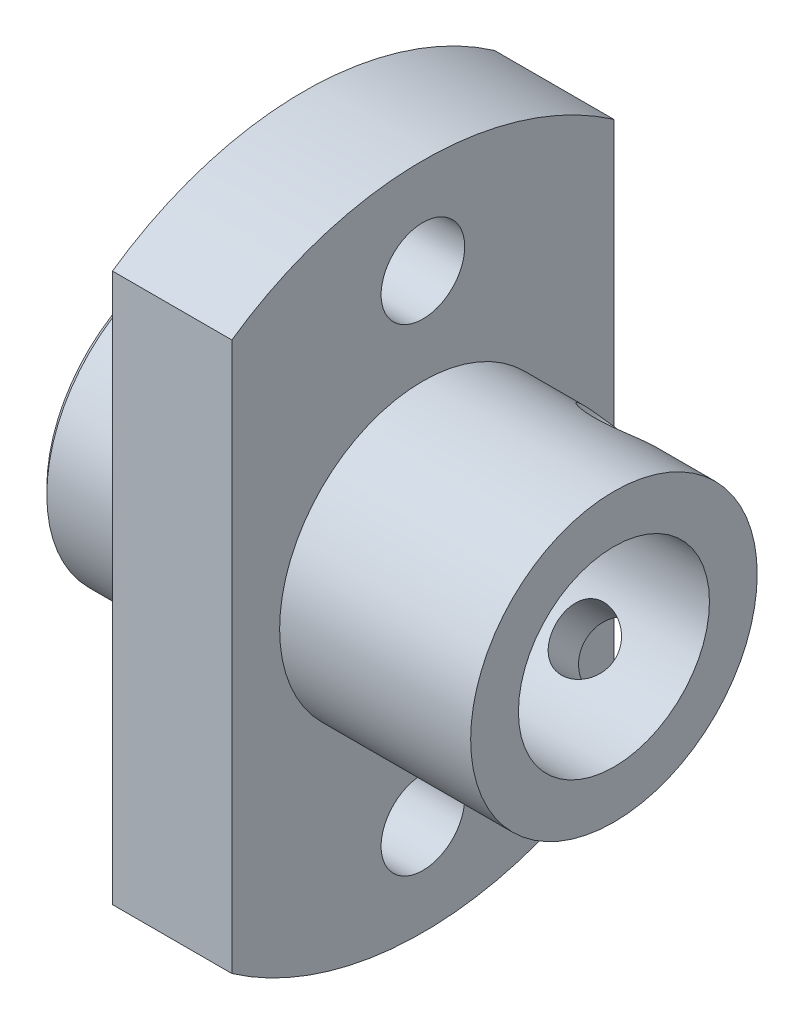
from build123d import *

# Parameters (mm, degrees)
CUT_EXTRUDE_1_DEPTH = 23.181073013
CHAMFER_1_SIZE      = 0.25
HOLE_WIZARD_1_D     = 3.5


# Read off the part's stored shape, not the designer's step: M3 螺纹孔3
with BuildPart() as part:
    # 草图2 → 旋转1 (revolve)
    with BuildSketch(Plane.XY, mode=Mode.PRIVATE) as revolve_1_sk:
        Polygon((18, 4), (18, 6), (10, 6), (10, 14), (5, 14), (5, 5.75), (4.5, 5.75), (4.5, 6), (0, 6), (0, 4), align=None)
    revolve(revolve_1_sk.sketch.rotate(Axis((0, 0, 0), (1, 0, 0)), 90), axis=Axis((0, 0, 0), (1, 0, 0)))

    # 草图3 → 切除-拉伸1 (cut, through all)
    with BuildSketch(Plane(origin=(10, 0, 0), x_dir=(0, 0, -1), z_dir=(1, 0, 0))):
        with BuildLine():
            Line((-8, -11.489125293), (-8, 11.489125293))
            ThreePointArc((-8, 11.489125293), (-14, 0), (-8, -11.489125293))
        make_face()
        with BuildLine():
            ThreePointArc((14, 0), (12.409673646, 6.480740698), (8, 11.489125293))
            Line((8, 11.489125293), (8, -11.489125293))
            ThreePointArc((8, -11.489125293), (12.409673646, -6.480740698), (14, 0))
        make_face()
    extrude(amount=-CUT_EXTRUDE_1_DEPTH, mode=Mode.SUBTRACT)

    # 倒角1
    chamfer_1_edges = [part.edges().sort_by_distance(p)[0] for p in [
        (0, 0, -6),
    ]]
    chamfer(chamfer_1_edges, length=CHAMFER_1_SIZE)

    # 孔1 (through all)
    with Locations(Plane(origin=(10, 0, 0), x_dir=(0, 0, -1), z_dir=(1, 0, 0))):
        with Locations((0, 10), (0, -10)):
            Hole(HOLE_WIZARD_1_D / 2)

    # M3 螺纹孔3 outline → M3 螺纹孔3 (revolve, cut)
    with BuildSketch(Plane(origin=(14, 0, 0), x_dir=(1, 0, 0), z_dir=(0, 0.707106781186545, 0.70710678118655))):
        Polygon((1.525087405, 6.000087405), (0, 6.000087405), (0, 3.799554737), (1.25, 3.799554737), (1.25, 5.725), align=None)
    revolve(axis=Axis((14, 0, 0), (0, 0.70710678118655, -0.707106781186545)), mode=Mode.SUBTRACT)

    # Hole Wizard M3 _3 2 outline → Hole Wizard M3 _3 2 (revolve, cut)
    with BuildSketch(Plane(origin=(14, 0, 0), x_dir=(1, 0, 0), z_dir=(0, -0.707106781186542, 0.707106781186553))):
        Polygon((0, -6.000094082), (1.525094082, -6.000094082), (1.25, -5.725), (1.25, -3.799554737), (0, -3.799554737), align=None)
    revolve(axis=Axis((14, 0, 0), (0, 0.707106781186553, 0.707106781186542)), mode=Mode.SUBTRACT)


solid = part.part
